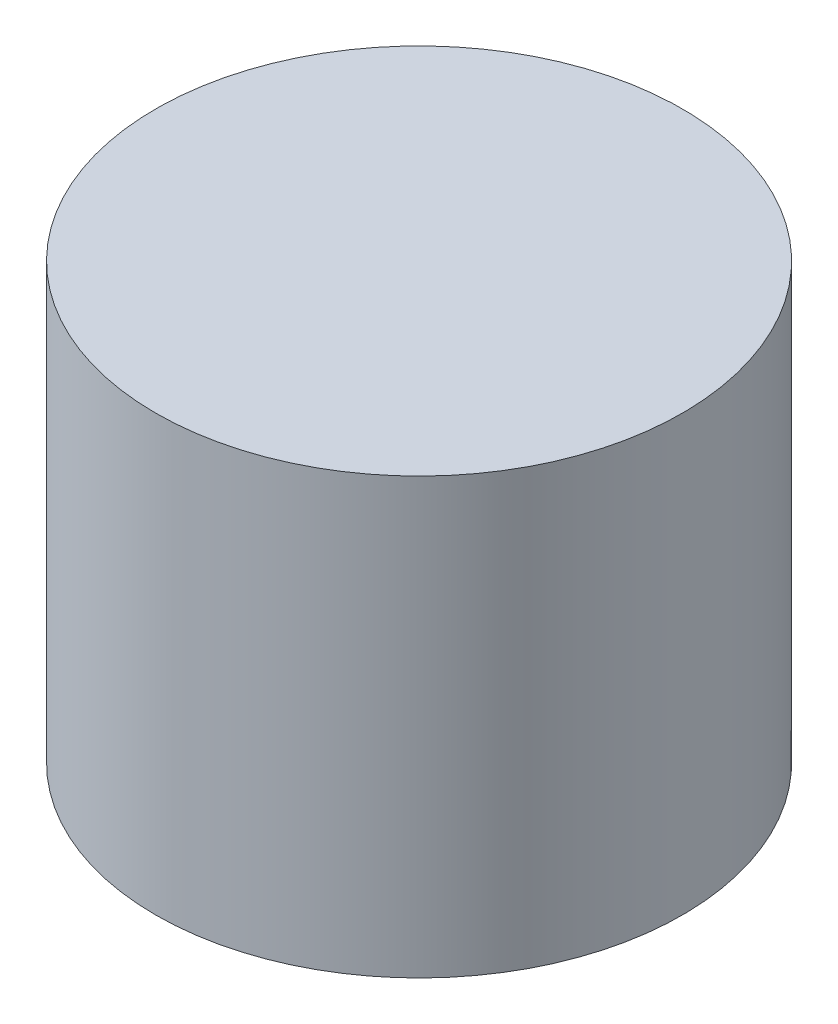
from build123d import *

# Parameters (mm, degrees)
SKETCH1_R           = 32
BOSS_EXTRUDE1_DEPTH = 26.4


with BuildPart() as part:
    # Sketch1 → Boss-Extrude1 (new, symmetric)
    with BuildSketch(Plane(origin=(0, 0, 0), x_dir=(1, 0, 0), z_dir=(0, 1, 0))):
        Circle(SKETCH1_R)
    extrude(amount=BOSS_EXTRUDE1_DEPTH, both=True)


solid = part.part
